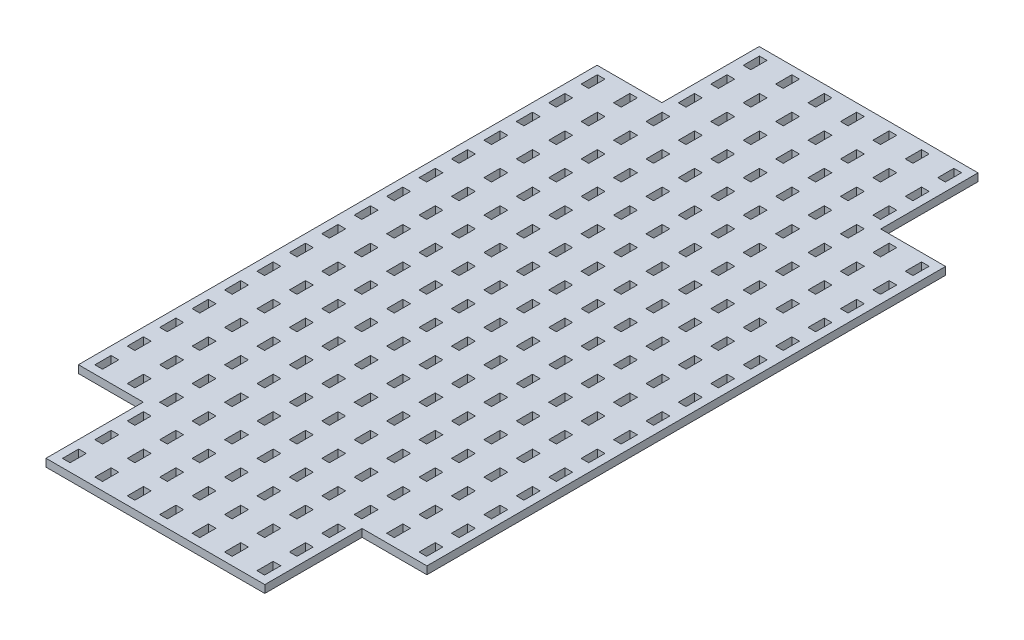
from build123d import *

# Parameters (mm, degrees)
SKETCH1_W              = 273.05
SKETCH1_H              = 558.8
BOSS_EXTRUDE1_DEPTH    = 3.0226
SKETCH2_W              = 5.969
SKETCH2_H              = 12.7
CUT_EXTRUDE1_DEPTH     = 312.030513082
LPATTERN1_COUNT        = 8
LPATTERN1_PITCH        = 25.4
LPATTERN1_COUNT_DIR2   = 8
LPATTERN1_PITCH_DIR2   = 25.4
LPATTERN2_START        = -129.9845
LPATTERN2_OUTLINE_W    = 6.0452
LPATTERN2_OUTLINE_H    = 12.7
LPATTERN2_DEPTH        = 5.969
LPATTERN2_START_2      = -104.5845
LPATTERN2_2_OUTLINE_W  = 6.0452
LPATTERN2_2_OUTLINE_H  = 12.7
LPATTERN2_2_DEPTH      = 5.969
LPATTERN2_START_3      = -79.1845
LPATTERN2_3_OUTLINE_W  = 6.0452
LPATTERN2_3_OUTLINE_H  = 12.7
LPATTERN2_3_DEPTH      = 5.969
LPATTERN2_START_4      = -53.7845
LPATTERN2_4_OUTLINE_W  = 6.0452
LPATTERN2_4_OUTLINE_H  = 12.7
LPATTERN2_4_DEPTH      = 5.969
LPATTERN2_START_5      = -28.3845
LPATTERN2_5_OUTLINE_W  = 6.0452
LPATTERN2_5_OUTLINE_H  = 12.7
LPATTERN2_5_DEPTH      = 5.969
LPATTERN2_START_6      = -2.9845
LPATTERN2_6_OUTLINE_W  = 6.0452
LPATTERN2_6_OUTLINE_H  = 12.7
LPATTERN2_6_DEPTH      = 5.969
LPATTERN2_START_7      = 22.4155
LPATTERN2_7_OUTLINE_W  = 6.0452
LPATTERN2_7_OUTLINE_H  = 12.7
LPATTERN2_7_DEPTH      = 5.969
LPATTERN2_START_8      = 47.8155
LPATTERN2_8_OUTLINE_W  = 6.0452
LPATTERN2_8_OUTLINE_H  = 12.7
LPATTERN2_8_DEPTH      = 5.969
LPATTERN2_START_9      = 73.2155
LPATTERN2_9_OUTLINE_W  = 6.0452
LPATTERN2_9_OUTLINE_H  = 12.7
LPATTERN2_9_DEPTH      = 5.969
LPATTERN2_START_10     = 98.6155
LPATTERN2_10_OUTLINE_W = 6.0452
LPATTERN2_10_OUTLINE_H = 12.7
LPATTERN2_10_DEPTH     = 5.969
LPATTERN2_START_11     = 124.0155
LPATTERN2_11_OUTLINE_W = 6.0452
LPATTERN2_11_OUTLINE_H = 12.7
LPATTERN2_11_DEPTH     = 5.969
SKETCH3_W              = 50.8
SKETCH3_H              = 76.2
CUT_EXTRUDE2_DEPTH     = 312.030513082


# Read off the part's stored shape, not the designer's step: LPattern2
with BuildPart() as part:
    # Sketch1 → Boss-Extrude1 (new, symmetric)
    with BuildSketch(Plane(origin=(0, 0, 0), x_dir=(1, 0, 0), z_dir=(0, 1, 0))):
        Rectangle(SKETCH1_W, SKETCH1_H)
    extrude(amount=BOSS_EXTRUDE1_DEPTH, both=True)

    # Sketch2 → Cut-Extrude1 (cut, through all)
    with BuildSketch(Plane(origin=(0, 3.0226, 0), x_dir=(1, 0, 0), z_dir=(0, 1, 0))):
        with Locations((0, 12.7)):
            Rectangle(SKETCH2_W, SKETCH2_H)
    cut_extrude1 = extrude(amount=-CUT_EXTRUDE1_DEPTH, mode=Mode.SUBTRACT)

    # LPattern1: Cut-Extrude1 8 × 8
    with Locations(*[Vector(1, 0, 0) * (i * LPATTERN1_PITCH) + Vector(-1, 0, 0) * (j * LPATTERN1_PITCH_DIR2) for i in range(LPATTERN1_COUNT) for j in range(LPATTERN1_COUNT_DIR2) if (i, j) != (0, 0)]):
        add(cut_extrude1, mode=Mode.SUBTRACT)

    # LPattern2 outline → LPattern2 (cut)
    with BuildSketch(Plane.YZ.offset(LPATTERN2_START)):
        with Locations((0, -38.1)):
            Rectangle(LPATTERN2_OUTLINE_W, LPATTERN2_OUTLINE_H)
        with Locations((0, 12.7)):
            Rectangle(LPATTERN2_OUTLINE_W, LPATTERN2_OUTLINE_H)
        with Locations((0, -63.5)):
            Rectangle(LPATTERN2_OUTLINE_W, LPATTERN2_OUTLINE_H)
        with Locations((0, 38.1)):
            Rectangle(LPATTERN2_OUTLINE_W, LPATTERN2_OUTLINE_H)
        with Locations((0, -88.9)):
            Rectangle(LPATTERN2_OUTLINE_W, LPATTERN2_OUTLINE_H)
        with Locations((0, 63.5)):
            Rectangle(LPATTERN2_OUTLINE_W, LPATTERN2_OUTLINE_H)
        with Locations((0, -114.3)):
            Rectangle(LPATTERN2_OUTLINE_W, LPATTERN2_OUTLINE_H)
        with Locations((0, 88.9)):
            Rectangle(LPATTERN2_OUTLINE_W, LPATTERN2_OUTLINE_H)
        with Locations((0, -139.7)):
            Rectangle(LPATTERN2_OUTLINE_W, LPATTERN2_OUTLINE_H)
        with Locations((0, 114.3)):
            Rectangle(LPATTERN2_OUTLINE_W, LPATTERN2_OUTLINE_H)
        with Locations((0, -165.1)):
            Rectangle(LPATTERN2_OUTLINE_W, LPATTERN2_OUTLINE_H)
        with Locations((0, 139.7)):
            Rectangle(LPATTERN2_OUTLINE_W, LPATTERN2_OUTLINE_H)
        with Locations((0, -190.5)):
            Rectangle(LPATTERN2_OUTLINE_W, LPATTERN2_OUTLINE_H)
        with Locations((0, 165.1)):
            Rectangle(LPATTERN2_OUTLINE_W, LPATTERN2_OUTLINE_H)
        with Locations((0, -215.9)):
            Rectangle(LPATTERN2_OUTLINE_W, LPATTERN2_OUTLINE_H)
        with Locations((0, 190.5)):
            Rectangle(LPATTERN2_OUTLINE_W, LPATTERN2_OUTLINE_H)
        with Locations((0, -241.3)):
            Rectangle(LPATTERN2_OUTLINE_W, LPATTERN2_OUTLINE_H)
        with Locations((0, 215.9)):
            Rectangle(LPATTERN2_OUTLINE_W, LPATTERN2_OUTLINE_H)
        with Locations((0, -266.7)):
            Rectangle(LPATTERN2_OUTLINE_W, LPATTERN2_OUTLINE_H)
        with Locations((0, 241.3)):
            Rectangle(LPATTERN2_OUTLINE_W, LPATTERN2_OUTLINE_H)
        with Locations((0, 266.7)):
            Rectangle(LPATTERN2_OUTLINE_W, LPATTERN2_OUTLINE_H)
    extrude(amount=LPATTERN2_DEPTH, mode=Mode.SUBTRACT)

    # LPattern2 2 outline → LPattern2 2 (cut)
    with BuildSketch(Plane.YZ.offset(LPATTERN2_START_2)):
        with Locations((0, -38.1)):
            Rectangle(LPATTERN2_2_OUTLINE_W, LPATTERN2_2_OUTLINE_H)
        with Locations((0, 12.7)):
            Rectangle(LPATTERN2_2_OUTLINE_W, LPATTERN2_2_OUTLINE_H)
        with Locations((0, -63.5)):
            Rectangle(LPATTERN2_2_OUTLINE_W, LPATTERN2_2_OUTLINE_H)
        with Locations((0, 38.1)):
            Rectangle(LPATTERN2_2_OUTLINE_W, LPATTERN2_2_OUTLINE_H)
        with Locations((0, -88.9)):
            Rectangle(LPATTERN2_2_OUTLINE_W, LPATTERN2_2_OUTLINE_H)
        with Locations((0, 63.5)):
            Rectangle(LPATTERN2_2_OUTLINE_W, LPATTERN2_2_OUTLINE_H)
        with Locations((0, -114.3)):
            Rectangle(LPATTERN2_2_OUTLINE_W, LPATTERN2_2_OUTLINE_H)
        with Locations((0, 88.9)):
            Rectangle(LPATTERN2_2_OUTLINE_W, LPATTERN2_2_OUTLINE_H)
        with Locations((0, -139.7)):
            Rectangle(LPATTERN2_2_OUTLINE_W, LPATTERN2_2_OUTLINE_H)
        with Locations((0, 114.3)):
            Rectangle(LPATTERN2_2_OUTLINE_W, LPATTERN2_2_OUTLINE_H)
        with Locations((0, -165.1)):
            Rectangle(LPATTERN2_2_OUTLINE_W, LPATTERN2_2_OUTLINE_H)
        with Locations((0, 139.7)):
            Rectangle(LPATTERN2_2_OUTLINE_W, LPATTERN2_2_OUTLINE_H)
        with Locations((0, -190.5)):
            Rectangle(LPATTERN2_2_OUTLINE_W, LPATTERN2_2_OUTLINE_H)
        with Locations((0, 165.1)):
            Rectangle(LPATTERN2_2_OUTLINE_W, LPATTERN2_2_OUTLINE_H)
        with Locations((0, -215.9)):
            Rectangle(LPATTERN2_2_OUTLINE_W, LPATTERN2_2_OUTLINE_H)
        with Locations((0, 190.5)):
            Rectangle(LPATTERN2_2_OUTLINE_W, LPATTERN2_2_OUTLINE_H)
        with Locations((0, -241.3)):
            Rectangle(LPATTERN2_2_OUTLINE_W, LPATTERN2_2_OUTLINE_H)
        with Locations((0, 215.9)):
            Rectangle(LPATTERN2_2_OUTLINE_W, LPATTERN2_2_OUTLINE_H)
        with Locations((0, -266.7)):
            Rectangle(LPATTERN2_2_OUTLINE_W, LPATTERN2_2_OUTLINE_H)
        with Locations((0, 241.3)):
            Rectangle(LPATTERN2_2_OUTLINE_W, LPATTERN2_2_OUTLINE_H)
        with Locations((0, 266.7)):
            Rectangle(LPATTERN2_2_OUTLINE_W, LPATTERN2_2_OUTLINE_H)
    extrude(amount=LPATTERN2_2_DEPTH, mode=Mode.SUBTRACT)

    # LPattern2 3 outline → LPattern2 3 (cut)
    with BuildSketch(Plane.YZ.offset(LPATTERN2_START_3)):
        with Locations((0, -38.1)):
            Rectangle(LPATTERN2_3_OUTLINE_W, LPATTERN2_3_OUTLINE_H)
        with Locations((0, 12.7)):
            Rectangle(LPATTERN2_3_OUTLINE_W, LPATTERN2_3_OUTLINE_H)
        with Locations((0, -63.5)):
            Rectangle(LPATTERN2_3_OUTLINE_W, LPATTERN2_3_OUTLINE_H)
        with Locations((0, 38.1)):
            Rectangle(LPATTERN2_3_OUTLINE_W, LPATTERN2_3_OUTLINE_H)
        with Locations((0, -88.9)):
            Rectangle(LPATTERN2_3_OUTLINE_W, LPATTERN2_3_OUTLINE_H)
        with Locations((0, 63.5)):
            Rectangle(LPATTERN2_3_OUTLINE_W, LPATTERN2_3_OUTLINE_H)
        with Locations((0, -114.3)):
            Rectangle(LPATTERN2_3_OUTLINE_W, LPATTERN2_3_OUTLINE_H)
        with Locations((0, 88.9)):
            Rectangle(LPATTERN2_3_OUTLINE_W, LPATTERN2_3_OUTLINE_H)
        with Locations((0, -139.7)):
            Rectangle(LPATTERN2_3_OUTLINE_W, LPATTERN2_3_OUTLINE_H)
        with Locations((0, 114.3)):
            Rectangle(LPATTERN2_3_OUTLINE_W, LPATTERN2_3_OUTLINE_H)
        with Locations((0, -165.1)):
            Rectangle(LPATTERN2_3_OUTLINE_W, LPATTERN2_3_OUTLINE_H)
        with Locations((0, 139.7)):
            Rectangle(LPATTERN2_3_OUTLINE_W, LPATTERN2_3_OUTLINE_H)
        with Locations((0, -190.5)):
            Rectangle(LPATTERN2_3_OUTLINE_W, LPATTERN2_3_OUTLINE_H)
        with Locations((0, 165.1)):
            Rectangle(LPATTERN2_3_OUTLINE_W, LPATTERN2_3_OUTLINE_H)
        with Locations((0, -215.9)):
            Rectangle(LPATTERN2_3_OUTLINE_W, LPATTERN2_3_OUTLINE_H)
        with Locations((0, 190.5)):
            Rectangle(LPATTERN2_3_OUTLINE_W, LPATTERN2_3_OUTLINE_H)
        with Locations((0, -241.3)):
            Rectangle(LPATTERN2_3_OUTLINE_W, LPATTERN2_3_OUTLINE_H)
        with Locations((0, 215.9)):
            Rectangle(LPATTERN2_3_OUTLINE_W, LPATTERN2_3_OUTLINE_H)
        with Locations((0, -266.7)):
            Rectangle(LPATTERN2_3_OUTLINE_W, LPATTERN2_3_OUTLINE_H)
        with Locations((0, 241.3)):
            Rectangle(LPATTERN2_3_OUTLINE_W, LPATTERN2_3_OUTLINE_H)
        with Locations((0, 266.7)):
            Rectangle(LPATTERN2_3_OUTLINE_W, LPATTERN2_3_OUTLINE_H)
    extrude(amount=LPATTERN2_3_DEPTH, mode=Mode.SUBTRACT)

    # LPattern2 4 outline → LPattern2 4 (cut)
    with BuildSketch(Plane.YZ.offset(LPATTERN2_START_4)):
        with Locations((0, -38.1)):
            Rectangle(LPATTERN2_4_OUTLINE_W, LPATTERN2_4_OUTLINE_H)
        with Locations((0, 12.7)):
            Rectangle(LPATTERN2_4_OUTLINE_W, LPATTERN2_4_OUTLINE_H)
        with Locations((0, -63.5)):
            Rectangle(LPATTERN2_4_OUTLINE_W, LPATTERN2_4_OUTLINE_H)
        with Locations((0, 38.1)):
            Rectangle(LPATTERN2_4_OUTLINE_W, LPATTERN2_4_OUTLINE_H)
        with Locations((0, -88.9)):
            Rectangle(LPATTERN2_4_OUTLINE_W, LPATTERN2_4_OUTLINE_H)
        with Locations((0, 63.5)):
            Rectangle(LPATTERN2_4_OUTLINE_W, LPATTERN2_4_OUTLINE_H)
        with Locations((0, -114.3)):
            Rectangle(LPATTERN2_4_OUTLINE_W, LPATTERN2_4_OUTLINE_H)
        with Locations((0, 88.9)):
            Rectangle(LPATTERN2_4_OUTLINE_W, LPATTERN2_4_OUTLINE_H)
        with Locations((0, -139.7)):
            Rectangle(LPATTERN2_4_OUTLINE_W, LPATTERN2_4_OUTLINE_H)
        with Locations((0, 114.3)):
            Rectangle(LPATTERN2_4_OUTLINE_W, LPATTERN2_4_OUTLINE_H)
        with Locations((0, -165.1)):
            Rectangle(LPATTERN2_4_OUTLINE_W, LPATTERN2_4_OUTLINE_H)
        with Locations((0, 139.7)):
            Rectangle(LPATTERN2_4_OUTLINE_W, LPATTERN2_4_OUTLINE_H)
        with Locations((0, -190.5)):
            Rectangle(LPATTERN2_4_OUTLINE_W, LPATTERN2_4_OUTLINE_H)
        with Locations((0, 165.1)):
            Rectangle(LPATTERN2_4_OUTLINE_W, LPATTERN2_4_OUTLINE_H)
        with Locations((0, -215.9)):
            Rectangle(LPATTERN2_4_OUTLINE_W, LPATTERN2_4_OUTLINE_H)
        with Locations((0, 190.5)):
            Rectangle(LPATTERN2_4_OUTLINE_W, LPATTERN2_4_OUTLINE_H)
        with Locations((0, -241.3)):
            Rectangle(LPATTERN2_4_OUTLINE_W, LPATTERN2_4_OUTLINE_H)
        with Locations((0, 215.9)):
            Rectangle(LPATTERN2_4_OUTLINE_W, LPATTERN2_4_OUTLINE_H)
        with Locations((0, -266.7)):
            Rectangle(LPATTERN2_4_OUTLINE_W, LPATTERN2_4_OUTLINE_H)
        with Locations((0, 241.3)):
            Rectangle(LPATTERN2_4_OUTLINE_W, LPATTERN2_4_OUTLINE_H)
        with Locations((0, 266.7)):
            Rectangle(LPATTERN2_4_OUTLINE_W, LPATTERN2_4_OUTLINE_H)
    extrude(amount=LPATTERN2_4_DEPTH, mode=Mode.SUBTRACT)

    # LPattern2 5 outline → LPattern2 5 (cut)
    with BuildSketch(Plane.YZ.offset(LPATTERN2_START_5)):
        with Locations((0, -38.1)):
            Rectangle(LPATTERN2_5_OUTLINE_W, LPATTERN2_5_OUTLINE_H)
        with Locations((0, 12.7)):
            Rectangle(LPATTERN2_5_OUTLINE_W, LPATTERN2_5_OUTLINE_H)
        with Locations((0, -63.5)):
            Rectangle(LPATTERN2_5_OUTLINE_W, LPATTERN2_5_OUTLINE_H)
        with Locations((0, 38.1)):
            Rectangle(LPATTERN2_5_OUTLINE_W, LPATTERN2_5_OUTLINE_H)
        with Locations((0, -88.9)):
            Rectangle(LPATTERN2_5_OUTLINE_W, LPATTERN2_5_OUTLINE_H)
        with Locations((0, 63.5)):
            Rectangle(LPATTERN2_5_OUTLINE_W, LPATTERN2_5_OUTLINE_H)
        with Locations((0, -114.3)):
            Rectangle(LPATTERN2_5_OUTLINE_W, LPATTERN2_5_OUTLINE_H)
        with Locations((0, 88.9)):
            Rectangle(LPATTERN2_5_OUTLINE_W, LPATTERN2_5_OUTLINE_H)
        with Locations((0, -139.7)):
            Rectangle(LPATTERN2_5_OUTLINE_W, LPATTERN2_5_OUTLINE_H)
        with Locations((0, 114.3)):
            Rectangle(LPATTERN2_5_OUTLINE_W, LPATTERN2_5_OUTLINE_H)
        with Locations((0, -165.1)):
            Rectangle(LPATTERN2_5_OUTLINE_W, LPATTERN2_5_OUTLINE_H)
        with Locations((0, 139.7)):
            Rectangle(LPATTERN2_5_OUTLINE_W, LPATTERN2_5_OUTLINE_H)
        with Locations((0, -190.5)):
            Rectangle(LPATTERN2_5_OUTLINE_W, LPATTERN2_5_OUTLINE_H)
        with Locations((0, 165.1)):
            Rectangle(LPATTERN2_5_OUTLINE_W, LPATTERN2_5_OUTLINE_H)
        with Locations((0, -215.9)):
            Rectangle(LPATTERN2_5_OUTLINE_W, LPATTERN2_5_OUTLINE_H)
        with Locations((0, 190.5)):
            Rectangle(LPATTERN2_5_OUTLINE_W, LPATTERN2_5_OUTLINE_H)
        with Locations((0, -241.3)):
            Rectangle(LPATTERN2_5_OUTLINE_W, LPATTERN2_5_OUTLINE_H)
        with Locations((0, 215.9)):
            Rectangle(LPATTERN2_5_OUTLINE_W, LPATTERN2_5_OUTLINE_H)
        with Locations((0, -266.7)):
            Rectangle(LPATTERN2_5_OUTLINE_W, LPATTERN2_5_OUTLINE_H)
        with Locations((0, 241.3)):
            Rectangle(LPATTERN2_5_OUTLINE_W, LPATTERN2_5_OUTLINE_H)
        with Locations((0, 266.7)):
            Rectangle(LPATTERN2_5_OUTLINE_W, LPATTERN2_5_OUTLINE_H)
    extrude(amount=LPATTERN2_5_DEPTH, mode=Mode.SUBTRACT)

    # LPattern2 6 outline → LPattern2 6 (cut)
    with BuildSketch(Plane.YZ.offset(LPATTERN2_START_6)):
        with Locations((0, -38.1)):
            Rectangle(LPATTERN2_6_OUTLINE_W, LPATTERN2_6_OUTLINE_H)
        with Locations((0, 12.7)):
            Rectangle(LPATTERN2_6_OUTLINE_W, LPATTERN2_6_OUTLINE_H)
        with Locations((0, -63.5)):
            Rectangle(LPATTERN2_6_OUTLINE_W, LPATTERN2_6_OUTLINE_H)
        with Locations((0, 38.1)):
            Rectangle(LPATTERN2_6_OUTLINE_W, LPATTERN2_6_OUTLINE_H)
        with Locations((0, -88.9)):
            Rectangle(LPATTERN2_6_OUTLINE_W, LPATTERN2_6_OUTLINE_H)
        with Locations((0, 63.5)):
            Rectangle(LPATTERN2_6_OUTLINE_W, LPATTERN2_6_OUTLINE_H)
        with Locations((0, -114.3)):
            Rectangle(LPATTERN2_6_OUTLINE_W, LPATTERN2_6_OUTLINE_H)
        with Locations((0, 88.9)):
            Rectangle(LPATTERN2_6_OUTLINE_W, LPATTERN2_6_OUTLINE_H)
        with Locations((0, -139.7)):
            Rectangle(LPATTERN2_6_OUTLINE_W, LPATTERN2_6_OUTLINE_H)
        with Locations((0, 114.3)):
            Rectangle(LPATTERN2_6_OUTLINE_W, LPATTERN2_6_OUTLINE_H)
        with Locations((0, -165.1)):
            Rectangle(LPATTERN2_6_OUTLINE_W, LPATTERN2_6_OUTLINE_H)
        with Locations((0, 139.7)):
            Rectangle(LPATTERN2_6_OUTLINE_W, LPATTERN2_6_OUTLINE_H)
        with Locations((0, -190.5)):
            Rectangle(LPATTERN2_6_OUTLINE_W, LPATTERN2_6_OUTLINE_H)
        with Locations((0, 165.1)):
            Rectangle(LPATTERN2_6_OUTLINE_W, LPATTERN2_6_OUTLINE_H)
        with Locations((0, -215.9)):
            Rectangle(LPATTERN2_6_OUTLINE_W, LPATTERN2_6_OUTLINE_H)
        with Locations((0, 190.5)):
            Rectangle(LPATTERN2_6_OUTLINE_W, LPATTERN2_6_OUTLINE_H)
        with Locations((0, -241.3)):
            Rectangle(LPATTERN2_6_OUTLINE_W, LPATTERN2_6_OUTLINE_H)
        with Locations((0, 215.9)):
            Rectangle(LPATTERN2_6_OUTLINE_W, LPATTERN2_6_OUTLINE_H)
        with Locations((0, -266.7)):
            Rectangle(LPATTERN2_6_OUTLINE_W, LPATTERN2_6_OUTLINE_H)
        with Locations((0, 241.3)):
            Rectangle(LPATTERN2_6_OUTLINE_W, LPATTERN2_6_OUTLINE_H)
        with Locations((0, 266.7)):
            Rectangle(LPATTERN2_6_OUTLINE_W, LPATTERN2_6_OUTLINE_H)
    extrude(amount=LPATTERN2_6_DEPTH, mode=Mode.SUBTRACT)

    # LPattern2 7 outline → LPattern2 7 (cut)
    with BuildSketch(Plane.YZ.offset(LPATTERN2_START_7)):
        with Locations((0, -38.1)):
            Rectangle(LPATTERN2_7_OUTLINE_W, LPATTERN2_7_OUTLINE_H)
        with Locations((0, 12.7)):
            Rectangle(LPATTERN2_7_OUTLINE_W, LPATTERN2_7_OUTLINE_H)
        with Locations((0, -63.5)):
            Rectangle(LPATTERN2_7_OUTLINE_W, LPATTERN2_7_OUTLINE_H)
        with Locations((0, 38.1)):
            Rectangle(LPATTERN2_7_OUTLINE_W, LPATTERN2_7_OUTLINE_H)
        with Locations((0, -88.9)):
            Rectangle(LPATTERN2_7_OUTLINE_W, LPATTERN2_7_OUTLINE_H)
        with Locations((0, 63.5)):
            Rectangle(LPATTERN2_7_OUTLINE_W, LPATTERN2_7_OUTLINE_H)
        with Locations((0, -114.3)):
            Rectangle(LPATTERN2_7_OUTLINE_W, LPATTERN2_7_OUTLINE_H)
        with Locations((0, 88.9)):
            Rectangle(LPATTERN2_7_OUTLINE_W, LPATTERN2_7_OUTLINE_H)
        with Locations((0, -139.7)):
            Rectangle(LPATTERN2_7_OUTLINE_W, LPATTERN2_7_OUTLINE_H)
        with Locations((0, 114.3)):
            Rectangle(LPATTERN2_7_OUTLINE_W, LPATTERN2_7_OUTLINE_H)
        with Locations((0, -165.1)):
            Rectangle(LPATTERN2_7_OUTLINE_W, LPATTERN2_7_OUTLINE_H)
        with Locations((0, 139.7)):
            Rectangle(LPATTERN2_7_OUTLINE_W, LPATTERN2_7_OUTLINE_H)
        with Locations((0, -190.5)):
            Rectangle(LPATTERN2_7_OUTLINE_W, LPATTERN2_7_OUTLINE_H)
        with Locations((0, 165.1)):
            Rectangle(LPATTERN2_7_OUTLINE_W, LPATTERN2_7_OUTLINE_H)
        with Locations((0, -215.9)):
            Rectangle(LPATTERN2_7_OUTLINE_W, LPATTERN2_7_OUTLINE_H)
        with Locations((0, 190.5)):
            Rectangle(LPATTERN2_7_OUTLINE_W, LPATTERN2_7_OUTLINE_H)
        with Locations((0, -241.3)):
            Rectangle(LPATTERN2_7_OUTLINE_W, LPATTERN2_7_OUTLINE_H)
        with Locations((0, 215.9)):
            Rectangle(LPATTERN2_7_OUTLINE_W, LPATTERN2_7_OUTLINE_H)
        with Locations((0, -266.7)):
            Rectangle(LPATTERN2_7_OUTLINE_W, LPATTERN2_7_OUTLINE_H)
        with Locations((0, 241.3)):
            Rectangle(LPATTERN2_7_OUTLINE_W, LPATTERN2_7_OUTLINE_H)
        with Locations((0, 266.7)):
            Rectangle(LPATTERN2_7_OUTLINE_W, LPATTERN2_7_OUTLINE_H)
    extrude(amount=LPATTERN2_7_DEPTH, mode=Mode.SUBTRACT)

    # LPattern2 8 outline → LPattern2 8 (cut)
    with BuildSketch(Plane.YZ.offset(LPATTERN2_START_8)):
        with Locations((0, -38.1)):
            Rectangle(LPATTERN2_8_OUTLINE_W, LPATTERN2_8_OUTLINE_H)
        with Locations((0, 12.7)):
            Rectangle(LPATTERN2_8_OUTLINE_W, LPATTERN2_8_OUTLINE_H)
        with Locations((0, -63.5)):
            Rectangle(LPATTERN2_8_OUTLINE_W, LPATTERN2_8_OUTLINE_H)
        with Locations((0, 38.1)):
            Rectangle(LPATTERN2_8_OUTLINE_W, LPATTERN2_8_OUTLINE_H)
        with Locations((0, -88.9)):
            Rectangle(LPATTERN2_8_OUTLINE_W, LPATTERN2_8_OUTLINE_H)
        with Locations((0, 63.5)):
            Rectangle(LPATTERN2_8_OUTLINE_W, LPATTERN2_8_OUTLINE_H)
        with Locations((0, -114.3)):
            Rectangle(LPATTERN2_8_OUTLINE_W, LPATTERN2_8_OUTLINE_H)
        with Locations((0, 88.9)):
            Rectangle(LPATTERN2_8_OUTLINE_W, LPATTERN2_8_OUTLINE_H)
        with Locations((0, -139.7)):
            Rectangle(LPATTERN2_8_OUTLINE_W, LPATTERN2_8_OUTLINE_H)
        with Locations((0, 114.3)):
            Rectangle(LPATTERN2_8_OUTLINE_W, LPATTERN2_8_OUTLINE_H)
        with Locations((0, -165.1)):
            Rectangle(LPATTERN2_8_OUTLINE_W, LPATTERN2_8_OUTLINE_H)
        with Locations((0, 139.7)):
            Rectangle(LPATTERN2_8_OUTLINE_W, LPATTERN2_8_OUTLINE_H)
        with Locations((0, -190.5)):
            Rectangle(LPATTERN2_8_OUTLINE_W, LPATTERN2_8_OUTLINE_H)
        with Locations((0, 165.1)):
            Rectangle(LPATTERN2_8_OUTLINE_W, LPATTERN2_8_OUTLINE_H)
        with Locations((0, -215.9)):
            Rectangle(LPATTERN2_8_OUTLINE_W, LPATTERN2_8_OUTLINE_H)
        with Locations((0, 190.5)):
            Rectangle(LPATTERN2_8_OUTLINE_W, LPATTERN2_8_OUTLINE_H)
        with Locations((0, -241.3)):
            Rectangle(LPATTERN2_8_OUTLINE_W, LPATTERN2_8_OUTLINE_H)
        with Locations((0, 215.9)):
            Rectangle(LPATTERN2_8_OUTLINE_W, LPATTERN2_8_OUTLINE_H)
        with Locations((0, -266.7)):
            Rectangle(LPATTERN2_8_OUTLINE_W, LPATTERN2_8_OUTLINE_H)
        with Locations((0, 241.3)):
            Rectangle(LPATTERN2_8_OUTLINE_W, LPATTERN2_8_OUTLINE_H)
        with Locations((0, 266.7)):
            Rectangle(LPATTERN2_8_OUTLINE_W, LPATTERN2_8_OUTLINE_H)
    extrude(amount=LPATTERN2_8_DEPTH, mode=Mode.SUBTRACT)

    # LPattern2 9 outline → LPattern2 9 (cut)
    with BuildSketch(Plane.YZ.offset(LPATTERN2_START_9)):
        with Locations((0, -38.1)):
            Rectangle(LPATTERN2_9_OUTLINE_W, LPATTERN2_9_OUTLINE_H)
        with Locations((0, 12.7)):
            Rectangle(LPATTERN2_9_OUTLINE_W, LPATTERN2_9_OUTLINE_H)
        with Locations((0, -63.5)):
            Rectangle(LPATTERN2_9_OUTLINE_W, LPATTERN2_9_OUTLINE_H)
        with Locations((0, 38.1)):
            Rectangle(LPATTERN2_9_OUTLINE_W, LPATTERN2_9_OUTLINE_H)
        with Locations((0, -88.9)):
            Rectangle(LPATTERN2_9_OUTLINE_W, LPATTERN2_9_OUTLINE_H)
        with Locations((0, 63.5)):
            Rectangle(LPATTERN2_9_OUTLINE_W, LPATTERN2_9_OUTLINE_H)
        with Locations((0, -114.3)):
            Rectangle(LPATTERN2_9_OUTLINE_W, LPATTERN2_9_OUTLINE_H)
        with Locations((0, 88.9)):
            Rectangle(LPATTERN2_9_OUTLINE_W, LPATTERN2_9_OUTLINE_H)
        with Locations((0, -139.7)):
            Rectangle(LPATTERN2_9_OUTLINE_W, LPATTERN2_9_OUTLINE_H)
        with Locations((0, 114.3)):
            Rectangle(LPATTERN2_9_OUTLINE_W, LPATTERN2_9_OUTLINE_H)
        with Locations((0, -165.1)):
            Rectangle(LPATTERN2_9_OUTLINE_W, LPATTERN2_9_OUTLINE_H)
        with Locations((0, 139.7)):
            Rectangle(LPATTERN2_9_OUTLINE_W, LPATTERN2_9_OUTLINE_H)
        with Locations((0, -190.5)):
            Rectangle(LPATTERN2_9_OUTLINE_W, LPATTERN2_9_OUTLINE_H)
        with Locations((0, 165.1)):
            Rectangle(LPATTERN2_9_OUTLINE_W, LPATTERN2_9_OUTLINE_H)
        with Locations((0, -215.9)):
            Rectangle(LPATTERN2_9_OUTLINE_W, LPATTERN2_9_OUTLINE_H)
        with Locations((0, 190.5)):
            Rectangle(LPATTERN2_9_OUTLINE_W, LPATTERN2_9_OUTLINE_H)
        with Locations((0, -241.3)):
            Rectangle(LPATTERN2_9_OUTLINE_W, LPATTERN2_9_OUTLINE_H)
        with Locations((0, 215.9)):
            Rectangle(LPATTERN2_9_OUTLINE_W, LPATTERN2_9_OUTLINE_H)
        with Locations((0, -266.7)):
            Rectangle(LPATTERN2_9_OUTLINE_W, LPATTERN2_9_OUTLINE_H)
        with Locations((0, 241.3)):
            Rectangle(LPATTERN2_9_OUTLINE_W, LPATTERN2_9_OUTLINE_H)
        with Locations((0, 266.7)):
            Rectangle(LPATTERN2_9_OUTLINE_W, LPATTERN2_9_OUTLINE_H)
    extrude(amount=LPATTERN2_9_DEPTH, mode=Mode.SUBTRACT)

    # LPattern2 10 outline → LPattern2 10 (cut)
    with BuildSketch(Plane.YZ.offset(LPATTERN2_START_10)):
        with Locations((0, -38.1)):
            Rectangle(LPATTERN2_10_OUTLINE_W, LPATTERN2_10_OUTLINE_H)
        with Locations((0, 12.7)):
            Rectangle(LPATTERN2_10_OUTLINE_W, LPATTERN2_10_OUTLINE_H)
        with Locations((0, -63.5)):
            Rectangle(LPATTERN2_10_OUTLINE_W, LPATTERN2_10_OUTLINE_H)
        with Locations((0, 38.1)):
            Rectangle(LPATTERN2_10_OUTLINE_W, LPATTERN2_10_OUTLINE_H)
        with Locations((0, -88.9)):
            Rectangle(LPATTERN2_10_OUTLINE_W, LPATTERN2_10_OUTLINE_H)
        with Locations((0, 63.5)):
            Rectangle(LPATTERN2_10_OUTLINE_W, LPATTERN2_10_OUTLINE_H)
        with Locations((0, -114.3)):
            Rectangle(LPATTERN2_10_OUTLINE_W, LPATTERN2_10_OUTLINE_H)
        with Locations((0, 88.9)):
            Rectangle(LPATTERN2_10_OUTLINE_W, LPATTERN2_10_OUTLINE_H)
        with Locations((0, -139.7)):
            Rectangle(LPATTERN2_10_OUTLINE_W, LPATTERN2_10_OUTLINE_H)
        with Locations((0, 114.3)):
            Rectangle(LPATTERN2_10_OUTLINE_W, LPATTERN2_10_OUTLINE_H)
        with Locations((0, -165.1)):
            Rectangle(LPATTERN2_10_OUTLINE_W, LPATTERN2_10_OUTLINE_H)
        with Locations((0, 139.7)):
            Rectangle(LPATTERN2_10_OUTLINE_W, LPATTERN2_10_OUTLINE_H)
        with Locations((0, -190.5)):
            Rectangle(LPATTERN2_10_OUTLINE_W, LPATTERN2_10_OUTLINE_H)
        with Locations((0, 165.1)):
            Rectangle(LPATTERN2_10_OUTLINE_W, LPATTERN2_10_OUTLINE_H)
        with Locations((0, -215.9)):
            Rectangle(LPATTERN2_10_OUTLINE_W, LPATTERN2_10_OUTLINE_H)
        with Locations((0, 190.5)):
            Rectangle(LPATTERN2_10_OUTLINE_W, LPATTERN2_10_OUTLINE_H)
        with Locations((0, -241.3)):
            Rectangle(LPATTERN2_10_OUTLINE_W, LPATTERN2_10_OUTLINE_H)
        with Locations((0, 215.9)):
            Rectangle(LPATTERN2_10_OUTLINE_W, LPATTERN2_10_OUTLINE_H)
        with Locations((0, -266.7)):
            Rectangle(LPATTERN2_10_OUTLINE_W, LPATTERN2_10_OUTLINE_H)
        with Locations((0, 241.3)):
            Rectangle(LPATTERN2_10_OUTLINE_W, LPATTERN2_10_OUTLINE_H)
        with Locations((0, 266.7)):
            Rectangle(LPATTERN2_10_OUTLINE_W, LPATTERN2_10_OUTLINE_H)
    extrude(amount=LPATTERN2_10_DEPTH, mode=Mode.SUBTRACT)

    # LPattern2 11 outline → LPattern2 11 (cut)
    with BuildSketch(Plane.YZ.offset(LPATTERN2_START_11)):
        with Locations((0, -38.1)):
            Rectangle(LPATTERN2_11_OUTLINE_W, LPATTERN2_11_OUTLINE_H)
        with Locations((0, 12.7)):
            Rectangle(LPATTERN2_11_OUTLINE_W, LPATTERN2_11_OUTLINE_H)
        with Locations((0, -63.5)):
            Rectangle(LPATTERN2_11_OUTLINE_W, LPATTERN2_11_OUTLINE_H)
        with Locations((0, 38.1)):
            Rectangle(LPATTERN2_11_OUTLINE_W, LPATTERN2_11_OUTLINE_H)
        with Locations((0, -88.9)):
            Rectangle(LPATTERN2_11_OUTLINE_W, LPATTERN2_11_OUTLINE_H)
        with Locations((0, 63.5)):
            Rectangle(LPATTERN2_11_OUTLINE_W, LPATTERN2_11_OUTLINE_H)
        with Locations((0, -114.3)):
            Rectangle(LPATTERN2_11_OUTLINE_W, LPATTERN2_11_OUTLINE_H)
        with Locations((0, 88.9)):
            Rectangle(LPATTERN2_11_OUTLINE_W, LPATTERN2_11_OUTLINE_H)
        with Locations((0, -139.7)):
            Rectangle(LPATTERN2_11_OUTLINE_W, LPATTERN2_11_OUTLINE_H)
        with Locations((0, 114.3)):
            Rectangle(LPATTERN2_11_OUTLINE_W, LPATTERN2_11_OUTLINE_H)
        with Locations((0, -165.1)):
            Rectangle(LPATTERN2_11_OUTLINE_W, LPATTERN2_11_OUTLINE_H)
        with Locations((0, 139.7)):
            Rectangle(LPATTERN2_11_OUTLINE_W, LPATTERN2_11_OUTLINE_H)
        with Locations((0, -190.5)):
            Rectangle(LPATTERN2_11_OUTLINE_W, LPATTERN2_11_OUTLINE_H)
        with Locations((0, 165.1)):
            Rectangle(LPATTERN2_11_OUTLINE_W, LPATTERN2_11_OUTLINE_H)
        with Locations((0, -215.9)):
            Rectangle(LPATTERN2_11_OUTLINE_W, LPATTERN2_11_OUTLINE_H)
        with Locations((0, 190.5)):
            Rectangle(LPATTERN2_11_OUTLINE_W, LPATTERN2_11_OUTLINE_H)
        with Locations((0, -241.3)):
            Rectangle(LPATTERN2_11_OUTLINE_W, LPATTERN2_11_OUTLINE_H)
        with Locations((0, 215.9)):
            Rectangle(LPATTERN2_11_OUTLINE_W, LPATTERN2_11_OUTLINE_H)
        with Locations((0, -266.7)):
            Rectangle(LPATTERN2_11_OUTLINE_W, LPATTERN2_11_OUTLINE_H)
        with Locations((0, 241.3)):
            Rectangle(LPATTERN2_11_OUTLINE_W, LPATTERN2_11_OUTLINE_H)
        with Locations((0, 266.7)):
            Rectangle(LPATTERN2_11_OUTLINE_W, LPATTERN2_11_OUTLINE_H)
    extrude(amount=LPATTERN2_11_DEPTH, mode=Mode.SUBTRACT)

    # Sketch3 → Cut-Extrude2 (cut, through all)
    with BuildSketch(Plane(origin=(0, 3.0226, 0), x_dir=(1, 0, 0), z_dir=(0, 1, 0))):
        with Locations((-111.125, -241.3)):
            Rectangle(SKETCH3_W, SKETCH3_H)
        with Locations((111.125, -241.3)):
            Rectangle(SKETCH3_W, SKETCH3_H)
        with Locations((111.125, 241.3)):
            Rectangle(SKETCH3_W, SKETCH3_H)
        with Locations((-111.125, 241.3)):
            Rectangle(SKETCH3_W, SKETCH3_H)
    extrude(amount=-CUT_EXTRUDE2_DEPTH, mode=Mode.SUBTRACT)


solid = part.part
